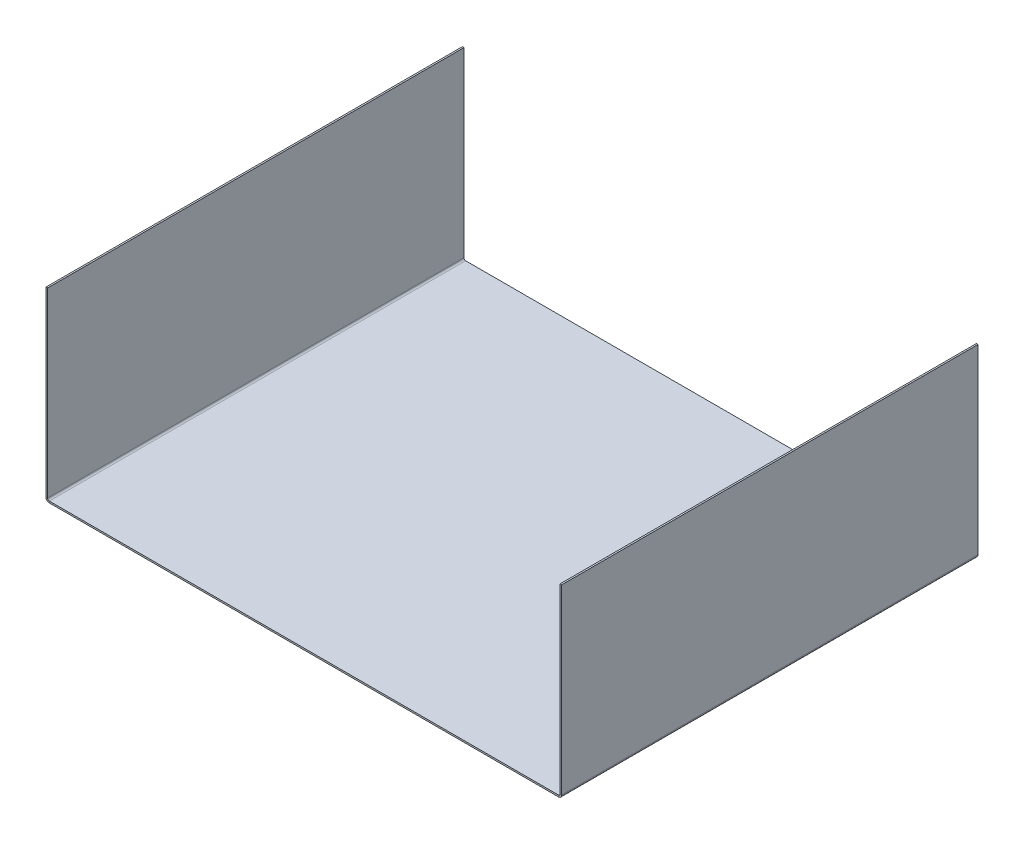
from build123d import *

# Parameters (mm, degrees)
SKETCH1_W                      = 223
SKETCH1_H                      = 180
BASE_FLANGE1_DEPTH             = 0.7
EDGE_FLANGE1_STRIP_W           = 4.2732
EDGE_FLANGE1_STRIP_H           = 0.7
EDGE_FLANGE1_STRIP_CUT_DEPTH   = 180
EDGE_FLANGE1_STRIP_2_W         = 4.2732
EDGE_FLANGE1_STRIP_2_H         = 0.7
EDGE_FLANGE1_STRIP_CUT_2_DEPTH = 180
EDGE_FLANGE1_DEPTH             = 180
EDGE_FLANGE1_BEND_DEPTH        = 180


# Sheet-metal steps are written as plain solids
with BuildPart() as part:
    # Sketch1 → Base-Flange1 (new body)
    with BuildSketch(Plane(origin=(0, 0, 0), x_dir=(1, 0, 0), z_dir=(0, 1, 0))):
        Rectangle(SKETCH1_W, SKETCH1_H)
    extrude(amount=-BASE_FLANGE1_DEPTH)

    # Edge-Flange1 strip (across the edge) → Edge-Flange1 strip cut (cut)
    with BuildSketch(Plane(origin=(-111.5, 0, -90), x_dir=(1, 0, 0), z_dir=(0, 0, 1))):
        with Locations((-0.7, -0.35)):
            Rectangle(EDGE_FLANGE1_STRIP_W, EDGE_FLANGE1_STRIP_H)
    extrude(amount=EDGE_FLANGE1_STRIP_CUT_DEPTH, mode=Mode.SUBTRACT)

    # Edge-Flange1 strip 2 (across the edge) → Edge-Flange1 strip cut 2 (cut)
    with BuildSketch(Plane(origin=(111.5, 0, 90), x_dir=(-1, 0, 0), z_dir=(0, 0, -1))):
        with Locations((-0.7, -0.35)):
            Rectangle(EDGE_FLANGE1_STRIP_2_W, EDGE_FLANGE1_STRIP_2_H)
    extrude(amount=EDGE_FLANGE1_STRIP_CUT_2_DEPTH, mode=Mode.SUBTRACT)

    # Edge-Flange1 section (across the edge) → Edge-Flange1 (add)
    with BuildSketch(Plane(origin=(-111.5, 0, -90), x_dir=(1, 0, 0), z_dir=(0, 0, 1))):
        with BuildLine():
            Line((0, 0.7366), (0, 79.4366))
            Line((0, 79.4366), (0.7, 79.4366))
            Line((0.7, 79.4366), (0.7, 0.7366))
            ThreePointArc((0.7, 0.7366), (0.915745145, 0.215745145), (1.4366, 0))
            Line((1.4366, 0), (1.4366, -0.7))
            ThreePointArc((1.4366, -0.7), (0.420770398, -0.279229602), (0, 0.7366))
        make_face()
    extrude(amount=EDGE_FLANGE1_DEPTH)

    # Edge-Flange1 section 2 (across the edge) → Edge-Flange1 bend (add)
    with BuildSketch(Plane(origin=(111.5, 0, 90), x_dir=(-1, 0, 0), z_dir=(0, 0, -1))):
        with BuildLine():
            Line((0, 0.7366), (0, 79.4366))
            Line((0, 79.4366), (0.7, 79.4366))
            Line((0.7, 79.4366), (0.7, 0.7366))
            ThreePointArc((0.7, 0.7366), (0.915745145, 0.215745145), (1.4366, 0))
            Line((1.4366, 0), (1.4366, -0.7))
            ThreePointArc((1.4366, -0.7), (0.420770398, -0.279229602), (0, 0.7366))
        make_face()
    extrude(amount=EDGE_FLANGE1_BEND_DEPTH)


solid = part.part
